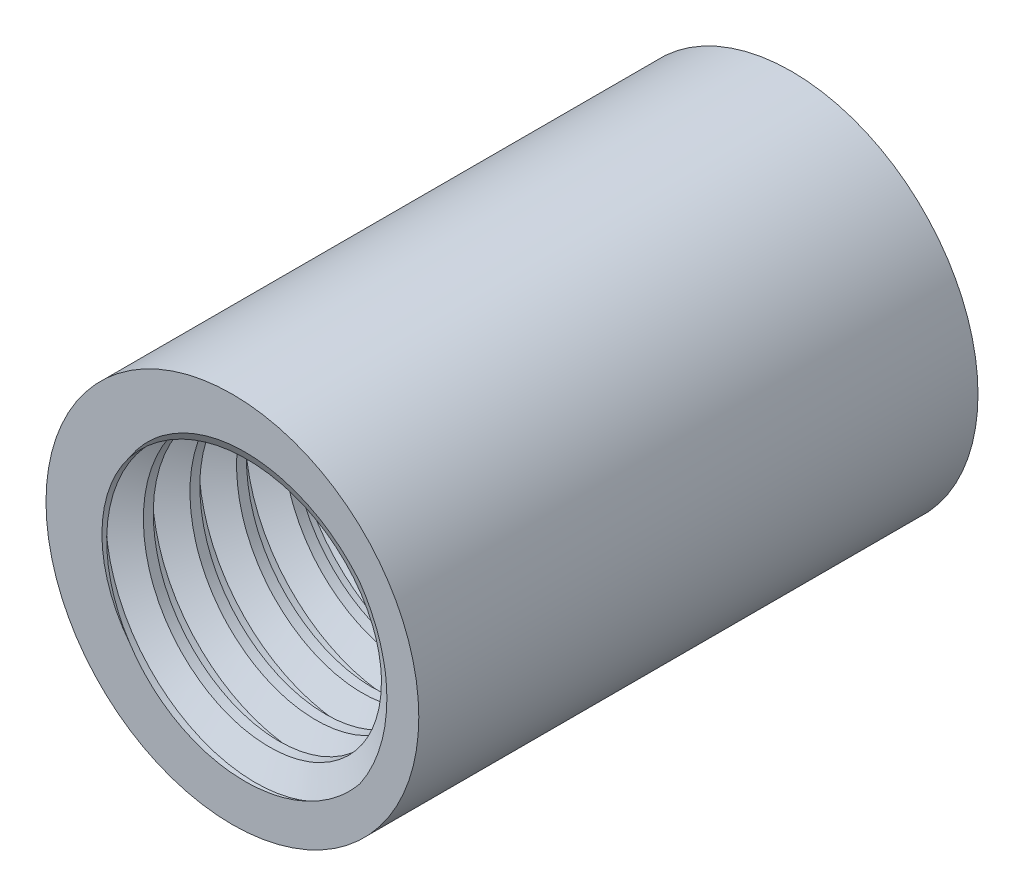
from build123d import *

# Parameters (mm, degrees)
SKETCH1_R           = 6.35
BOSS_EXTRUDE1_DEPTH = 19.05
SKETCH2_R           = 4.445
CUT_EXTRUDE1_DEPTH  = 22.060567419
CUT_SWEEP1_PITCH    = 1.5875


with BuildPart() as part:
    # Sketch1 → Boss-Extrude1 (new body)
    with BuildSketch(Plane.XY):
        with Locations(Location((0, 0, 0), (0, 0, 180))):
            Circle(SKETCH1_R)
    extrude(amount=BOSS_EXTRUDE1_DEPTH)

    # Sketch2 → Cut-Extrude1 (cut, through all)
    with BuildSketch(Plane.XY):
        with Locations(Location((0, 0, 0), (0, 0, 180))):
            Circle(SKETCH2_R)
    extrude(amount=CUT_EXTRUDE1_DEPTH, mode=Mode.SUBTRACT)

    # Cut-Sweep1: arcs per turn and ends read off the stored shape
    # Cut-Sweep1: the profile of Sketch4 profile screwed along a right-hand helix through 17 turns, 8 arcs to a turn; built about Z, then put on its axis
    cut_sweep1_z = Axis((0, 0, 0), (0, 0, 1))
    cut_sweep1_corners = [(4.4447, 0, -0.962486795), (4.4447, 0, -2.212513205), (5.263290084, 0, -1.7399), (5.263290084, 0, -1.4351)]
    with BuildLine(mode=Mode.PRIVATE) as cut_sweep1_profile:
        Line(cut_sweep1_corners[0], cut_sweep1_corners[1])
        Line(cut_sweep1_corners[1], cut_sweep1_corners[2])
        Line(cut_sweep1_corners[2], cut_sweep1_corners[3])
        Line(cut_sweep1_corners[3], cut_sweep1_corners[0])
    cut_sweep1_cap = Face(cut_sweep1_profile.wire())
    cut_sweep1_turn_angles = [0, 22.5, 45, 67.5, 90, 112.5, 135, 157.5, 180, 202.5, 225, 247.5, 270, 292.5, 315, 337.5, 360]
    cut_sweep1_turn_weights = [1, 0.9238795325112867, 1, 0.9238795325112867, 1, 0.9238795325112867, 1, 0.9238795325112867, 1, 0.9238795325112867, 1, 0.9238795325112867, 1, 0.9238795325112867, 1, 0.9238795325112867, 1]
    cut_sweep1_turn_rails = [Edge.make_bspline([Vector(p[0], p[1], 0).rotate(cut_sweep1_z, cut_sweep1_turn_angles[k]) / cut_sweep1_turn_weights[k] + Vector(0, 0, p[2] + CUT_SWEEP1_PITCH * cut_sweep1_turn_angles[k] / 360) for k in range(17)], [0, 0, 0, 1, 1, 2, 2, 3, 3, 4, 4, 5, 5, 6, 6, 7, 7, 8, 8, 8], 2, cut_sweep1_turn_weights) for p in cut_sweep1_corners]
    cut_sweep1_turn_sides = [Face.make_surface_from_curves(cut_sweep1_turn_rails[p[0]], cut_sweep1_turn_rails[p[1]]) for p in [(0, 1), (1, 2), (2, 3), (3, 0)]]
    cut_sweep1 = Plane(origin=(0, 0, 0), x_dir=(1, 0, 0), z_dir=(0, 0, 1)) * Solid(Shell([*[p.moved(Location((0, 0, CUT_SWEEP1_PITCH * i))) for i in range(17) for p in cut_sweep1_turn_sides], cut_sweep1_cap, cut_sweep1_cap.rotate(cut_sweep1_z, 6120).moved(Location((0, 0, CUT_SWEEP1_PITCH * 6120 / 360)))]))
    add(cut_sweep1, mode=Mode.SUBTRACT)


solid = part.part
